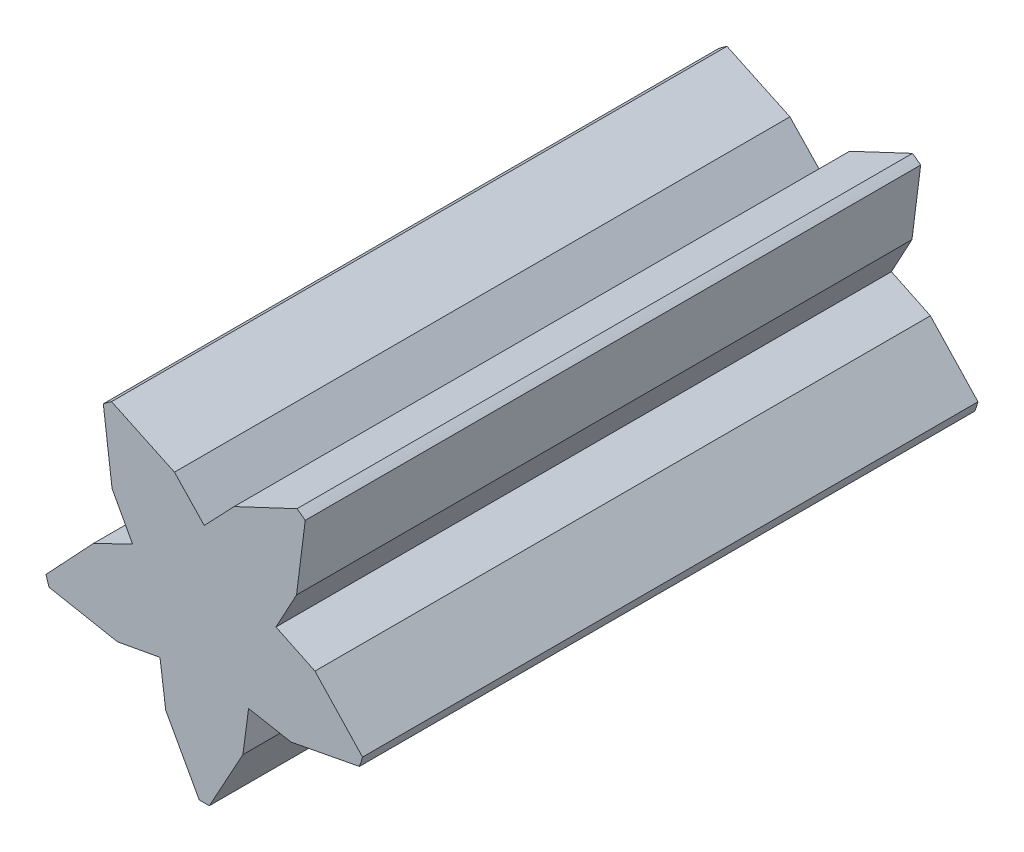
from build123d import *

# Parameters (mm, degrees)
SKETCH1_R           = 7.5
BOSS_EXTRUDE1_DEPTH = 28
CUT_EXTRUDE1_DEPTH  = 30.941609843
CIRPATTERN1_COUNT   = 5


with BuildPart() as part:
    # Sketch1 → Boss-Extrude1 (new body)
    with BuildSketch(Plane.XY):
        Circle(SKETCH1_R)
    extrude(amount=BOSS_EXTRUDE1_DEPTH)

    # Sketch2 → Cut-Extrude1 (cut, through all)
    with BuildSketch(Plane.XY):
        Polygon((0, 3.429306859), (-1.35645876, 4.852854397), (-4.219139018, 6.200714954), (0, 11.25164702), (4.219139018, 6.200714954), (1.35645876, 4.852854397), align=None)
    cut_extrude1 = extrude(amount=CUT_EXTRUDE1_DEPTH, mode=Mode.SUBTRACT)

    # CirPattern1: Cut-Extrude1 ×5 about axis
    cirpattern1_axis = Axis((0, 0, 28), (0, 0, -1))
    for i in range(1, CIRPATTERN1_COUNT):
        add(cut_extrude1.rotate(cirpattern1_axis, i * 360 / CIRPATTERN1_COUNT), mode=Mode.SUBTRACT)


solid = part.part
